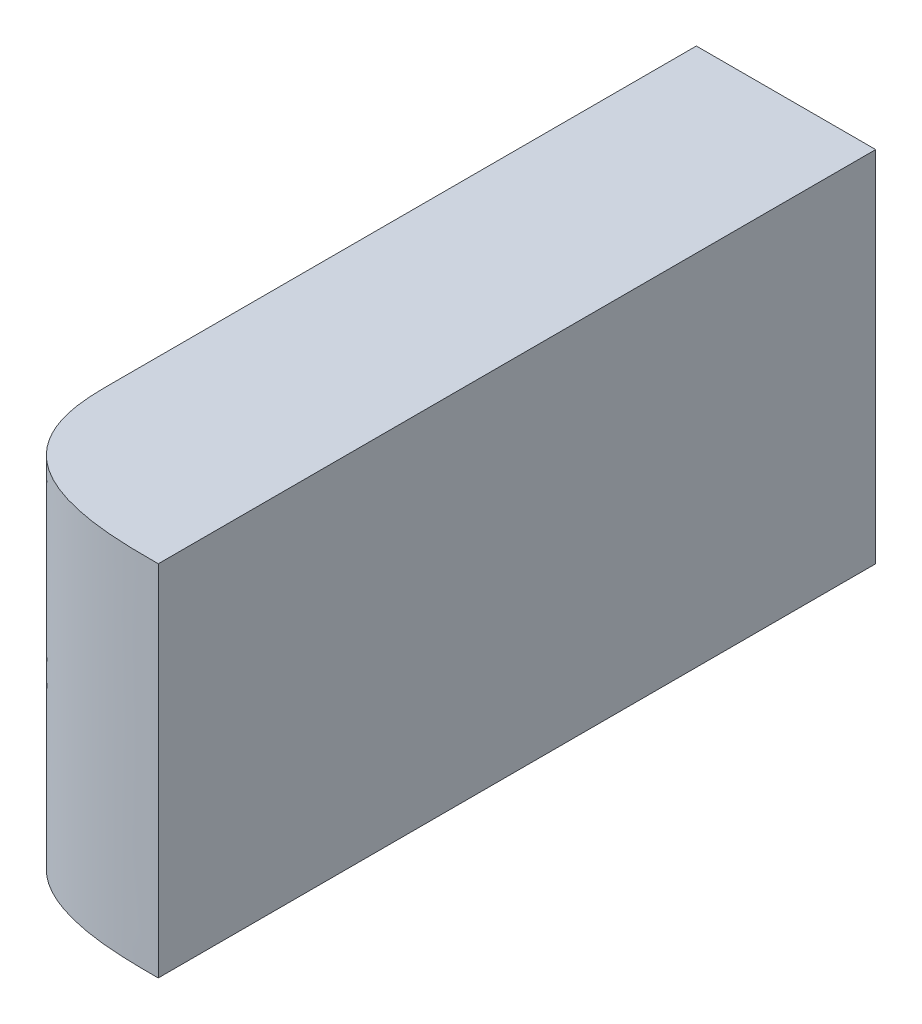
from build123d import *

# Parameters (mm, degrees)
SKETCH1_W           = 25
SKETCH1_H           = 100
BOSS_EXTRUDE1_DEPTH = 50
FILLET1_START       = -1
FILLET1_DEPTH       = 52


with BuildPart() as part:
    # Sketch1 → Boss-Extrude1 (new body)
    with BuildSketch(Plane(origin=(0, 0, 0), x_dir=(1, 0, 0), z_dir=(0, 1, 0))):
        Rectangle(SKETCH1_W, SKETCH1_H)
    extrude(amount=BOSS_EXTRUDE1_DEPTH)

    # Fillet1: read off the stored shape, not the designer's step
    # Fillet1 outline → Fillet1 (cut)
    with BuildSketch(Plane(origin=(0, 0, 0), x_dir=(1, 0, 0), z_dir=(0, 1, 0)).offset(FILLET1_START)):
        with BuildLine():
            Line((-12.5, -50), (12.5, -50))
            add(Edge.make_bspline(
                [(12.5, -50), (8.295048712, -50), (4.090097423, -50), (-5.17766953, -48.66385604), (-10.707702004, -44.541260632), (-12.5, -37.632213775), (-12.5, -34.497455895), (-12.5, -31.362698016)],
                knots=[0, 0, 0, 0, 0, 0, 0.5, 0.5, 1, 1, 1, 1, 1, 1], degree=5))
            Line((-12.5, -31.362698016), (-12.5, -50))
        make_face()
    extrude(amount=FILLET1_DEPTH, mode=Mode.SUBTRACT)


solid = part.part
